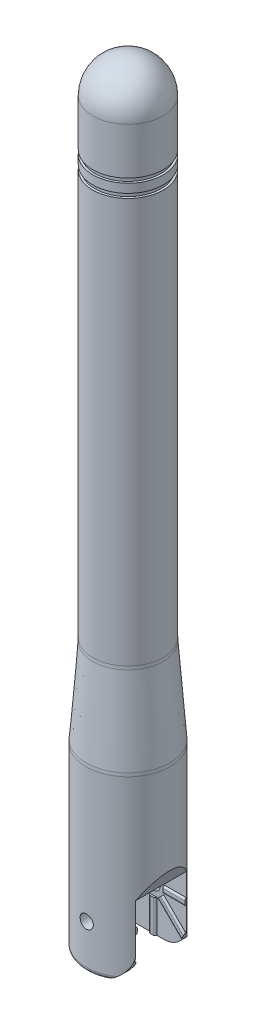
from build123d import *

# Parameters (mm, degrees)
ESQUISSE3_W                  = 7.5
ESQUISSE3_H                  = 5.8
ENL_V_MAT_EXTRU_1_DEPTH      = 8
CONG_1_R                     = 0.5
ENL_V_MAT_EXTRU_2_DEPTH      = 89.156310052
ENL_V_MAT_EXTRU_2_DEPTH_BACK = 89.156310052
ESQUISSE4_R                  = 0.75
ESQUISSE5_W                  = 0.75
ESQUISSE5_H                  = 3.75
ESQUISSE5_W_2                = 2.511980861
ESQUISSE5_H_2                = 0.75
BOSS_EXTRU_1_DEPTH           = 0.2
CONG_2_R                     = 0.2
CONG_2_OF_SYM_TRIE1_R        = 0.2
ENL_V_MAT_EXTRU_3_DEPTH      = 89.360030571


with BuildPart() as part:
    # Esquisse2 → Révolution1 (revolve)
    with BuildSketch(Plane.XY, mode=Mode.PRIVATE) as r_volution1_sk:
        with BuildLine():
            Line((4.014003451, 30.213287326), (4.735996549, 20.586712674))
            ThreePointArc((4.735996549, 20.586712674), (4.746497911, 20.399868856), (4.75, 20.212762933))
            Line((4.75, 20.212762933), (4.75, 0))
            Line((4.75, 0), (1, 0))
            Line((1, 0), (1, 83.9))
            Line((1, 83.9), (0, 83.9))
            Line((0, 83.9), (0, 87.9))
            ThreePointArc((0, 87.9), (2.828427125, 86.728427125), (4, 83.9))
            Line((4, 83.9), (4, 78.6))
            Line((4, 78.6), (3.75, 78.6))
            Line((3.75, 78.6), (3.75, 78.1))
            Line((3.75, 78.1), (4, 78.1))
            Line((4, 78.1), (4, 77.1))
            Line((4, 77.1), (3.75, 77.1))
            Line((3.75, 77.1), (3.75, 76.6))
            Line((3.75, 76.6), (4, 76.6))
            Line((4, 76.6), (4, 30.587237067))
            ThreePointArc((4, 30.587237067), (4.003502089, 30.400131144), (4.014003451, 30.213287326))
        make_face()
    revolve(r_volution1_sk.sketch.rotate(Axis((0, 0, 0), (0, 1, 0)), 90), axis=Axis((0, 0, 0), (0, 1, 0)))

    # Esquisse3 → Enlèv. mat.-Extru.1 (cut)
    with BuildSketch(Plane.XZ):
        with Locations((1, 0)):
            Rectangle(ESQUISSE3_W, ESQUISSE3_H)
    extrude(amount=-ENL_V_MAT_EXTRU_1_DEPTH, mode=Mode.SUBTRACT)

    # Congé1
    cong_1_edges = [part.edges().sort_by_distance(p)[0] for p in [
        (-4.262481672, 0, 2.096127382),
    ]]
    fillet(cong_1_edges, radius=CONG_1_R)

    # Esquisse4 → Enlèv. mat.-Extru.2 (cut, two sides: drawn at the far end of the back side and taken through both)
    with BuildSketch(Plane.XY.offset(-ENL_V_MAT_EXTRU_2_DEPTH_BACK)):
        with Locations(Location((0, 5, 0), (0, 0, 90))):
            Circle(ESQUISSE4_R)
        with BuildLine():
            Line((1.161980861, 0), (3.761980861, 0))
            Line((3.761980861, 0), (3.761980861, 2.6))
            ThreePointArc((3.761980861, 2.6), (3.000458492, 0.761522369), (1.161980861, 0))
        make_face()
        Polygon((3.761980861, 8), (4.75, 10), (4.75, 8), align=None)
    extrude(amount=ENL_V_MAT_EXTRU_2_DEPTH + ENL_V_MAT_EXTRU_2_DEPTH_BACK, mode=Mode.SUBTRACT)

    # Esquisse5 → Boss.-Extru.1 (add)
    with BuildSketch(Plane.XY.offset(-2.9)):
        with Locations((0, 1.875)):
            Rectangle(ESQUISSE5_W, ESQUISSE5_H)
        Polygon((0.618718434, 3.850951481), (1.149048519, 4.381281566), (4.027145904, 1.503184182), (3.496815818, 0.972854096), align=None)
        with Locations((2.50599043, 5)):
            Rectangle(ESQUISSE5_W_2, ESQUISSE5_H_2)
    boss_extru_1 = extrude(amount=BOSS_EXTRU_1_DEPTH)

    # Congé2
    cong_2_edges = [part.edges().sort_by_distance(p)[0] for p in [
        (2.505990431, 5.375, -2.7),
        (2.505990431, 4.625, -2.7),
        (2.588097212, 2.942232874, -2.7),
        (2.057767126, 2.411902788, -2.7),
        (-0.375, 1.875, -2.7),
        (0.375, 1.875, -2.7),
    ]]
    fillet(cong_2_edges, radius=CONG_2_R - 0.0001)  # a hair under: the kernel refuses the full size

    # Symétrie1: Boss.-Extru.1 across plane
    add(boss_extru_1.mirror(Plane.XY))

    # Congé2 of Symétrie1
    cong_2_of_sym_trie1_edges = [part.edges().sort_by_distance(p)[0] for p in [
        (2.505990431, 5.375, 2.7),
        (2.505990431, 4.625, 2.7),
        (2.588097212, 2.942232874, 2.7),
        (2.057767126, 2.411902788, 2.7),
        (-0.375, 1.875, 2.7),
        (0.375, 1.875, 2.7),
    ]]
    fillet(cong_2_of_sym_trie1_edges, radius=CONG_2_OF_SYM_TRIE1_R - 0.0001)  # a hair under: the kernel refuses the full size

    # Esquisse6 → Enlèv. mat.-Extru.3 (cut, through all)
    with BuildSketch(Plane.XY.offset(2.9)):
        with BuildLine():
            Line((4.027145904, 1.503184182), (3.658059706, 1.87227038))
            ThreePointArc((3.658059706, 1.87227038), (3.516870908, 1.49795968), (3.319930166, 1.149739748))
            Line((3.319930166, 1.149739748), (3.496815818, 0.972854096))
            Line((3.496815818, 0.972854096), (4.027145904, 1.503184182))
        make_face()
    extrude(amount=-ENL_V_MAT_EXTRU_3_DEPTH, mode=Mode.SUBTRACT)


solid = part.part
